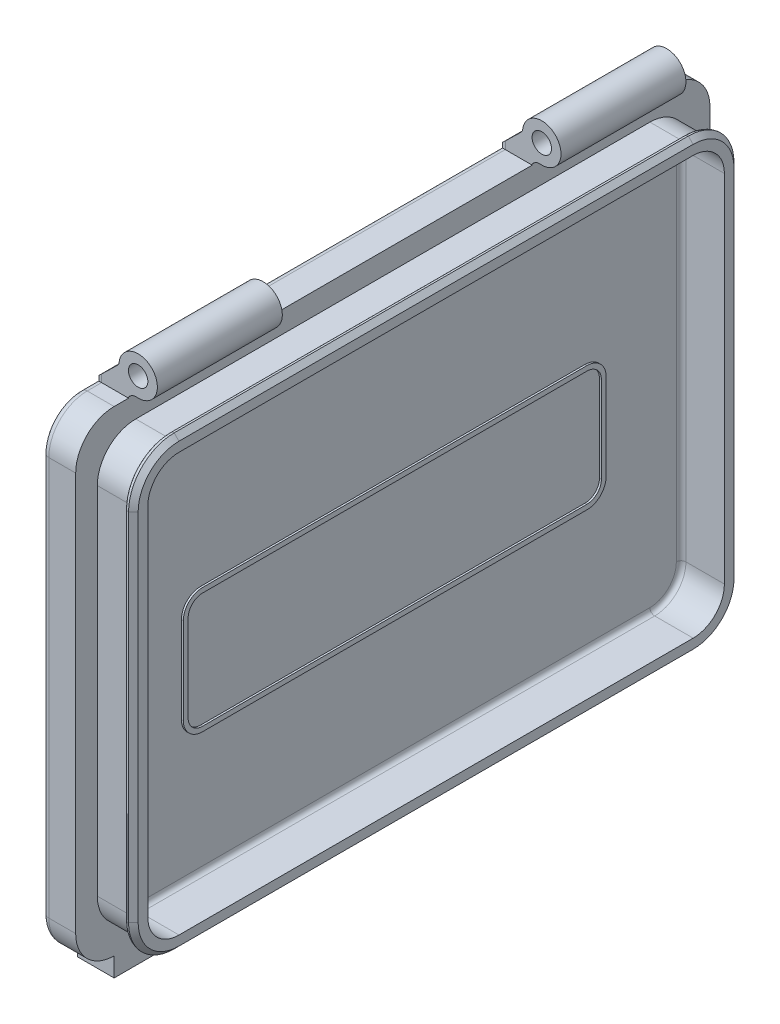
from build123d import *

# Parameters (mm, degrees)
SKETCH1_R            = 1
BOSS_EXTRUDE1_DEPTH  = 27.5
SKETCH2_R            = 1.01
BOSS_EXTRUDE2_DEPTH  = 13
SKETCH3_W            = 3.5
SKETCH3_H            = 13
BOSS_EXTRUDE3_DEPTH  = 49.6
SKETCH7_W            = 3.5
SKETCH7_H            = 49.5
BOSS_EXTRUDE6_DEPTH  = 5.5
SKETCH8_W            = 3.5
SKETCH8_H            = 49.5
BOSS_EXTRUDE7_DEPTH  = 14.5
FILLET2_R            = 4
BOSS_EXTRUDE8_DEPTH  = 29
BOSS_EXTRUDE9_DEPTH  = 0.2
BOSS_EXTRUDE11_DEPTH = 3.5
BOSS_EXTRUDE12_DEPTH = 1
FILLET2_OF_MIRROR1_R = 4
SKETCH15_R           = 1
CUT_EXTRUDE1_DEPTH   = 82.236014181
CHAMFER1_SIZE        = 0.5
FILLET3_R            = 0.5
FILLET4_R            = 0.5
FILLET6_R            = 0.7


with BuildPart() as part:
    # Sketch1 → Boss-Extrude1 (new body)
    with BuildSketch(Plane.XY):
        Circle(SKETCH1_R)
    boss_extrude1 = extrude(amount=BOSS_EXTRUDE1_DEPTH)


with BuildPart() as body_2:
    # Sketch2 → Boss-Extrude2 (new body)
    with BuildSketch(Plane.XY.offset(27.5)):
        with BuildLine():
            Line((-2.136524473, -0.092095918), (-4.5, -2.4))
            Line((-4.5, -2.4), (-1, -2.4))
            ThreePointArc((-1, -2.4), (-0.559963282, -2.050091796), (0, -2))
            ThreePointArc((0, -2), (1.487450997, 1.336970281), (-1.988677777, 0.212510468))
            ThreePointArc((-1.988677777, 0.212510468), (-2.036032236, 0.047311543), (-2.136524473, -0.092095918))
        make_face()
        Circle(SKETCH2_R, mode=Mode.SUBTRACT)
    boss_extrude2 = extrude(amount=-BOSS_EXTRUDE2_DEPTH)

    # Sketch3 → Boss-Extrude3 (add)
    with BuildSketch(Plane.XZ.offset(2.4)):
        with Locations((-2.75, 21)):
            Rectangle(SKETCH3_W, SKETCH3_H)
    boss_extrude3 = extrude(amount=BOSS_EXTRUDE3_DEPTH)

    # Sketch7 → Boss-Extrude6 (add)
    with BuildSketch(Plane.XY.offset(27.5)):
        with Locations((-2.75, -27.25)):
            Rectangle(SKETCH7_W, SKETCH7_H)
    boss_extrude6 = extrude(amount=BOSS_EXTRUDE6_DEPTH)

    # Sketch8 → Boss-Extrude7 (add)
    with BuildSketch(Plane(origin=(0, 0, 14.5), x_dir=(-1, 0, 0), z_dir=(0, 0, -1))):
        with Locations((2.75, -27.25)):
            Rectangle(SKETCH8_W, SKETCH8_H)
    boss_extrude7 = extrude(amount=BOSS_EXTRUDE7_DEPTH)

    # Fillet2
    fillet2_edges = [body_2.edges().sort_by_distance(p)[0] for p in [
        (-2.75, -2.5, 33),
        (-2.75, -52, 33),
    ]]
    fillet(fillet2_edges, radius=FILLET2_R)

    # Sketch10 → Boss-Extrude8 (add)
    with BuildSketch(Plane(origin=(0, 0, 0), x_dir=(-1, 0, 0), z_dir=(0, 0, -1))):
        Polygon((3.8, -52), (1, -52), (1, -54), (4.8, -54), (4.8, -53), (3.8, -53), align=None)
    boss_extrude8 = extrude(amount=-BOSS_EXTRUDE8_DEPTH)

    # Sketch11 → Boss-Extrude9 (add)
    with BuildSketch(Plane(origin=(-1, 0, 0), x_dir=(0, 0, -1), z_dir=(1, 0, 0))):
        with BuildLine():
            Line((0, -36.209762403), (-20, -36.209762403))
            ThreePointArc((-20, -36.209762403), (-21.414213562, -35.623975965), (-22, -34.209762403))
            Line((-22, -34.209762403), (-22, -25.209762403))
            ThreePointArc((-22, -25.209762403), (-21.414213562, -23.795548841), (-20, -23.209762403))
            Line((-20, -23.209762403), (0, -23.209762403))
            Line((0, -23.209762403), (0, -23.709762403))
            Line((0, -23.709762403), (-0.5, -23.709762403))
            Line((-0.5, -23.709762403), (-20, -23.709762403))
            ThreePointArc((-20, -23.709762403), (-21.060660172, -24.149102231), (-21.5, -25.209762403))
            Line((-21.5, -25.209762403), (-21.5, -34.209762403))
            ThreePointArc((-21.5, -34.209762403), (-21.060660172, -35.270422575), (-20, -35.709762403))
            Line((-20, -35.709762403), (-0.5, -35.709762403))
            Line((-0.5, -35.709762403), (0, -35.709762403))
            Line((0, -35.709762403), (0, -36.209762403))
        make_face()
    boss_extrude9 = extrude(amount=BOSS_EXTRUDE9_DEPTH)

    # Sketch13 → Boss-Extrude11 (add)
    with BuildSketch(Plane(origin=(-1, 0, 0), x_dir=(0, 0, -1), z_dir=(1, 0, 0))):
        with BuildLine():
            Line((-26.75, -5.5), (-0.75, -5.5))
            Line((-0.75, -5.5), (0, -5.5))
            Line((0, -5.5), (0, -4.75))
            Line((0, -4.75), (-26.75, -4.75))
            ThreePointArc((-26.75, -4.75), (-29.578427125, -5.921572875), (-30.75, -8.75))
            Line((-30.75, -8.75), (-30.75, -45.75))
            ThreePointArc((-30.75, -45.75), (-29.578427125, -48.578427125), (-26.75, -49.75))
            Line((-26.75, -49.75), (0, -49.75))
            Line((0, -49.75), (0, -49))
            Line((0, -49), (-0.75, -49))
            Line((-0.75, -49), (-26.75, -49))
            ThreePointArc((-26.75, -49), (-29.048097039, -48.048097039), (-30, -45.75))
            Line((-30, -45.75), (-30, -8.75))
            ThreePointArc((-30, -8.75), (-29.048097039, -6.451902961), (-26.75, -5.5))
        make_face()
    boss_extrude11 = extrude(amount=BOSS_EXTRUDE11_DEPTH)

    # Sketch14 → Boss-Extrude12 (add)
    with BuildSketch(Plane(origin=(2.5, 0, 0), x_dir=(0, 0, -1), z_dir=(1, 0, 0))):
        with BuildLine():
            Line((0, -49), (-26.75, -49))
            ThreePointArc((-26.75, -49), (-29.048097039, -48.048097039), (-30, -45.75))
            Line((-30, -45.75), (-30, -8.75))
            ThreePointArc((-30, -8.75), (-29.048097039, -6.451902961), (-26.75, -5.5))
            Line((-26.75, -5.5), (0, -5.5))
            Line((0, -5.5), (0, -4))
            Line((0, -4), (-26.75, -4))
            ThreePointArc((-26.75, -4), (-30.108757211, -5.391242789), (-31.5, -8.75))
            Line((-31.5, -8.75), (-31.5, -45.75))
            ThreePointArc((-31.5, -45.75), (-30.108757211, -49.108757211), (-26.75, -50.5))
            Line((-26.75, -50.5), (0, -50.5))
            Line((0, -50.5), (0, -49))
        make_face()
    boss_extrude12 = extrude(amount=BOSS_EXTRUDE12_DEPTH)


with BuildPart() as part_1:
    add(part.part)

    add(body_2.part)  # Mirror1 merges body 2
    # Mirror1: Boss-Extrude1, Boss-Extrude2, Boss-Extrude3, Boss-Extrude6, Boss-Extrude7, Boss-Extrude8, Boss-Extrude9, Boss-Extrude11, Boss-Extrude12 across plane
    add(boss_extrude1.mirror(Plane(origin=(0, 0, 0), x_dir=(1, 0, 0), z_dir=(0, 0, -1))))
    add(boss_extrude2.mirror(Plane(origin=(0, 0, 0), x_dir=(1, 0, 0), z_dir=(0, 0, -1))))
    add(boss_extrude3.mirror(Plane(origin=(0, 0, 0), x_dir=(1, 0, 0), z_dir=(0, 0, -1))))
    add(boss_extrude6.mirror(Plane(origin=(0, 0, 0), x_dir=(1, 0, 0), z_dir=(0, 0, -1))))
    add(boss_extrude7.mirror(Plane(origin=(0, 0, 0), x_dir=(1, 0, 0), z_dir=(0, 0, -1))))
    add(boss_extrude8.mirror(Plane(origin=(0, 0, 0), x_dir=(1, 0, 0), z_dir=(0, 0, -1))))
    add(boss_extrude9.mirror(Plane(origin=(0, 0, 0), x_dir=(1, 0, 0), z_dir=(0, 0, -1))))
    add(boss_extrude11.mirror(Plane(origin=(0, 0, 0), x_dir=(1, 0, 0), z_dir=(0, 0, -1))))
    add(boss_extrude12.mirror(Plane(origin=(0, 0, 0), x_dir=(1, 0, 0), z_dir=(0, 0, -1))))

    # Fillet2 of Mirror1
    fillet2_of_mirror1_edges = [part_1.edges().sort_by_distance(p)[0] for p in [
        (-2.75, -2.5, -33),
        (-2.75, -52, -33),
    ]]
    fillet(fillet2_of_mirror1_edges, radius=FILLET2_OF_MIRROR1_R)

    # Sketch15 → Cut-Extrude1 (cut, through all)
    with BuildSketch(Plane(origin=(0, 0, -27.5), x_dir=(-1, 0, 0), z_dir=(0, 0, -1))):
        Circle(SKETCH15_R)
    extrude(amount=-CUT_EXTRUDE1_DEPTH, mode=Mode.SUBTRACT)

    # Chamfer1
    chamfer1_edges = [part_1.edges().sort_by_distance(p)[0] for p in [
        (3.5, -4, 0),
        (3.5, -5.391242789, 30.108757211),
        (3.5, -27.25, 31.5),
        (3.5, -49.108757211, 30.108757211),
        (3.5, -50.5, 0),
        (3.5, -5.391242789, -30.108757211),
        (3.5, -27.25, -31.5),
        (3.5, -49.108757211, -30.108757211),
    ]]
    chamfer(chamfer1_edges, length=CHAMFER1_SIZE)

    # Fillet3
    fillet3_edges = [part_1.edges().sort_by_distance(p)[0] for p in [
        (2.5, -4, 0),
        (2.5, -5.391242789, 30.108757211),
        (2.5, -27.25, 31.5),
        (2.5, -49.108757211, 30.108757211),
        (2.5, -50.5, 0),
        (2.5, -49.108757211, -30.108757211),
        (2.5, -27.25, -31.5),
        (2.5, -5.391242789, -30.108757211),
    ]]
    fillet(fillet3_edges, radius=FILLET3_R - 0.0001)  # a hair under: the kernel refuses the full size

    # Fillet4
    fillet4_edges = [part_1.edges().sort_by_distance(p)[0] for p in [
        (-1, -49, 0),
        (-1, -48.048097039, 29.048097039),
        (-1, -27.25, 30),
        (-1, -6.451902961, 29.048097039),
        (-1, -5.5, 0),
        (-1, -48.048097039, -29.048097039),
        (-1, -27.25, -30),
        (-1, -6.451902961, -29.048097039),
    ]]
    fillet(fillet4_edges, radius=FILLET4_R)

    # Fillet6
    fillet6_edges = [part_1.edges().sort_by_distance(p)[0] for p in [
        (-4.5, -50.828427125, -31.828427125),
        (-4.5, -27.25, -33),
        (-4.5, -3.671572875, -31.828427125),
        (-4.5, -2.5, -28.25),
        (-4.5, -2.45, -27.5),
        (-4.5, -2.4, -21),
        (-4.5, -2.45, -14.5),
        (-4.5, -2.5, 0),
        (-4.5, -2.45, 14.5),
        (-4.5, -2.4, 21),
        (-4.5, -2.45, 27.5),
        (-4.5, -2.5, 28.25),
        (-4.5, -3.671572875, 31.828427125),
        (-4.5, -27.25, 33),
        (-4.5, -50.828427125, 31.828427125),
        (-4.5, -52, 0),
    ]]
    fillet(fillet6_edges, radius=FILLET6_R - 0.0001)  # a hair under: the kernel refuses the full size


solid = part_1.part
